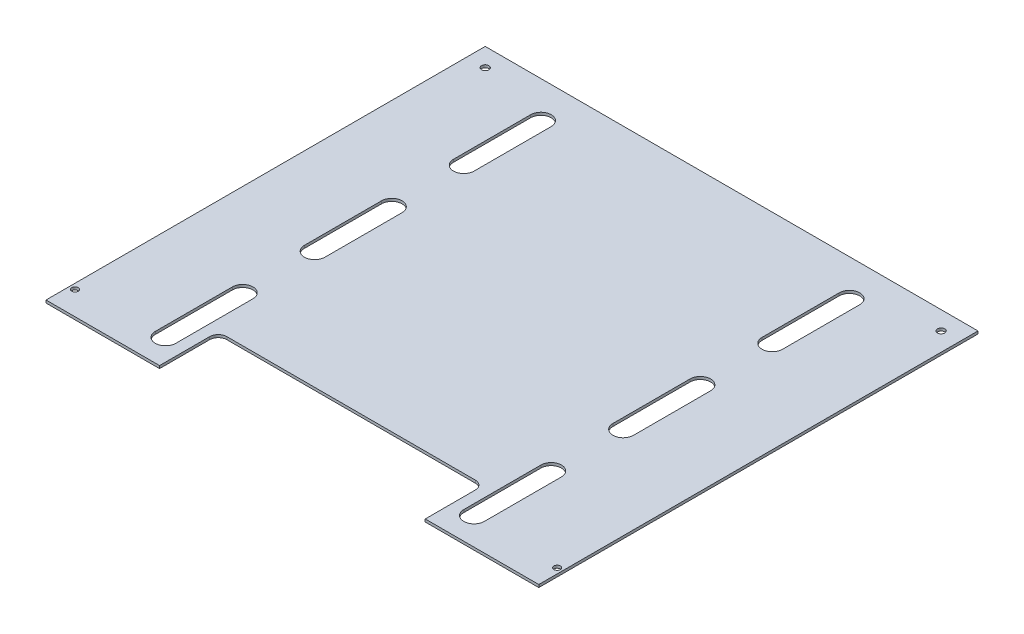
from build123d import *

# Parameters (mm, degrees)
SKETCH1_W            = 292.1
SKETCH1_H            = 260.35
SKETCH1_R            = 2.15265
BOSS_EXTRUDE1_DEPTH  = 1.5875
CUT_EXTRUDE2_DEPTH   = 196.649311988
LPATTERN2_COUNT      = 3
LPATTERN2_PITCH      = 88.392
MIRROR1_COPY_1_DEPTH = 196.649311988
MIRROR1_COPY_2_DEPTH = 196.649311988
SKETCH6_R            = 1.89865
CUT_EXTRUDE3_DEPTH   = 196.649311988
SKETCH7_W            = 157.48
SKETCH7_H            = 34.798
CUT_EXTRUDE4_DEPTH   = 196.649311988
FILLET1_R            = 5.08


with BuildPart() as part:
    # Sketch1 → Boss-Extrude1 (new body)
    with BuildSketch(Plane(origin=(0, 0, 0), x_dir=(1, 0, 0), z_dir=(0, 1, 0))):
        Rectangle(SKETCH1_W, SKETCH1_H)
        with Locations((-135.128, 119.253)):
            Circle(SKETCH1_R, mode=Mode.SUBTRACT)
        with Locations((135.128, 119.253)):
            Circle(SKETCH1_R, mode=Mode.SUBTRACT)
    extrude(amount=BOSS_EXTRUDE1_DEPTH)

    # Sketch5 → Cut-Extrude2 (cut, through all)
    with BuildSketch(Plane(origin=(0, 1.5875, 0), x_dir=(1, 0, 0), z_dir=(0, 1, 0))):
        with BuildLine():
            Line((-85.344, 108.585), (-85.344, 62.865))
            ThreePointArc((-85.344, 62.865), (-91.44, 56.769), (-97.536, 62.865))
            Line((-97.536, 62.865), (-97.536, 108.585))
            ThreePointArc((-97.536, 108.585), (-91.44, 114.681), (-85.344, 108.585))
        make_face()
    cut_extrude2 = extrude(amount=-CUT_EXTRUDE2_DEPTH, mode=Mode.SUBTRACT)

    # LPattern2: Cut-Extrude2 ×3
    with Locations(*[(0, 0, i * LPATTERN2_PITCH) for i in range(1, LPATTERN2_COUNT)]):
        add(cut_extrude2, mode=Mode.SUBTRACT)

    # Mirror1: Cut-Extrude2 across plane
    add(cut_extrude2.mirror(Plane(origin=(0, 0, 0), x_dir=(0, 0, 1), z_dir=(1, 0, 0))), mode=Mode.SUBTRACT)

    # Mirror1 copy 1 sketch → Mirror1 copy 1 (cut, through all)
    with BuildSketch(Plane(origin=(0, 1.5875, 88.392), x_dir=(-1, 0, 0), z_dir=(0, 1, 0))):
        with BuildLine():
            Line((-85.344, -108.585), (-85.344, -62.865))
            ThreePointArc((-85.344, -62.865), (-91.44, -56.769), (-97.536, -62.865))
            Line((-97.536, -62.865), (-97.536, -108.585))
            ThreePointArc((-97.536, -108.585), (-91.44, -114.681), (-85.344, -108.585))
        make_face()
    extrude(amount=-MIRROR1_COPY_1_DEPTH, mode=Mode.SUBTRACT)

    # Mirror1 copy 2 sketch → Mirror1 copy 2 (cut, through all)
    with BuildSketch(Plane(origin=(0, 1.5875, 176.784), x_dir=(-1, 0, 0), z_dir=(0, 1, 0))):
        with BuildLine():
            Line((-85.344, -108.585), (-85.344, -62.865))
            ThreePointArc((-85.344, -62.865), (-91.44, -56.769), (-97.536, -62.865))
            Line((-97.536, -62.865), (-97.536, -108.585))
            ThreePointArc((-97.536, -108.585), (-91.44, -114.681), (-85.344, -108.585))
        make_face()
    extrude(amount=-MIRROR1_COPY_2_DEPTH, mode=Mode.SUBTRACT)

    # Sketch6 → Cut-Extrude3 (cut, through all)
    with BuildSketch(Plane(origin=(0, 1.5875, 0), x_dir=(1, 0, 0), z_dir=(0, 1, 0))):
        with Locations((-142.875, -116.1542)):
            Circle(SKETCH6_R)
        with Locations((142.875, -116.1542)):
            Circle(SKETCH6_R)
    extrude(amount=-CUT_EXTRUDE3_DEPTH, mode=Mode.SUBTRACT)

    # Sketch7 → Cut-Extrude4 (cut, through all)
    with BuildSketch(Plane(origin=(0, 1.5875, 0), x_dir=(1, 0, 0), z_dir=(0, 1, 0))):
        with Locations((0, -112.776)):
            Rectangle(SKETCH7_W, SKETCH7_H)
    extrude(amount=-CUT_EXTRUDE4_DEPTH, mode=Mode.SUBTRACT)

    # Fillet1
    fillet1_edges = [part.edges().sort_by_distance(p)[0] for p in [
        (78.74, 0.79375, 95.377),
        (-78.74, 0.79375, 95.377),
    ]]
    fillet(fillet1_edges, radius=FILLET1_R)


solid = part.part
